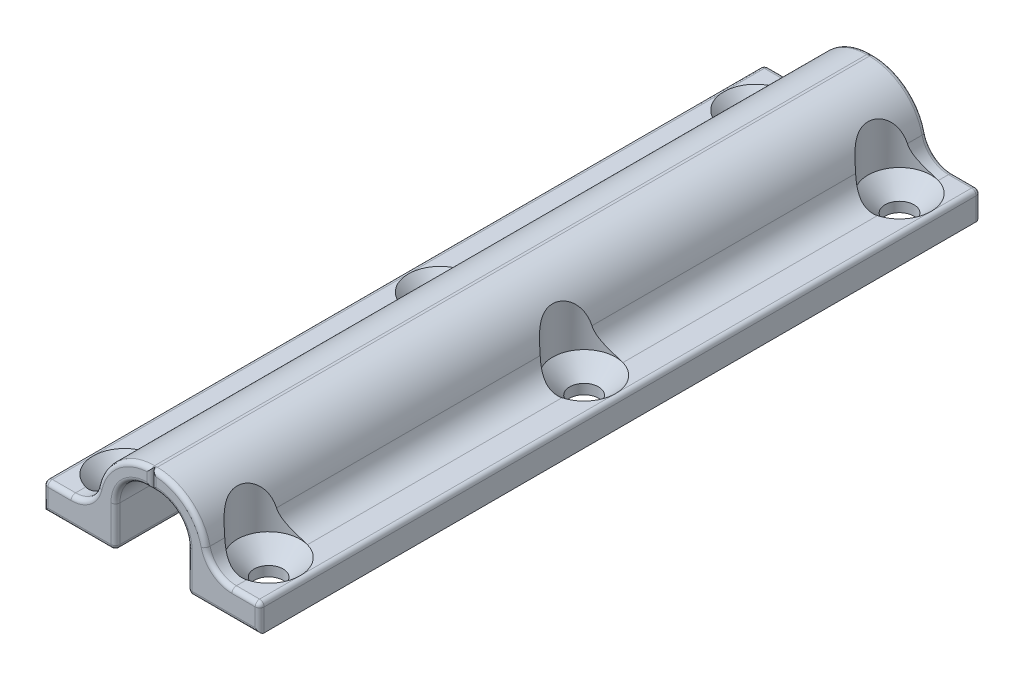
from build123d import *

# Parameters (mm, degrees)
BOSS_EXTRUDE1_DEPTH                            = 80
SKETCH2_R                                      = 1.4
CUT_EXTRUDE1_DEPTH                             = 82.197290595
CSK_FOR_M5_FLAT_HEAD_MACHINE_SCREW1_AT_2_COUNT = 2
CSK_FOR_M5_FLAT_HEAD_MACHINE_SCREW1_AT_2_PITCH = 35
CSK_FOR_M5_FLAT_HEAD_MACHINE_SCREW1_AT_3_COUNT = 2
CSK_FOR_M5_FLAT_HEAD_MACHINE_SCREW1_AT_3_PITCH = 70
SKETCH6_R                                      = 3.5
CUT_EXTRUDE2_DEPTH                             = 82.197290694
FILLET1_R                                      = 0.5


# Read off the part's stored shape, not the designer's step: Mirror1
with BuildPart() as part:
    # Sketch1 → Boss-Extrude1 (new body)
    with BuildSketch(Plane.XY):
        with BuildLine():
            Line((4, 0), (12, 0))
            Line((12, 0), (12, 3))
            Line((12, 3), (8.924988129, 3))
            ThreePointArc((8.924988129, 3), (7.054159436, 3.65479212), (6, 5.333333333))
            ThreePointArc((6, 5.333333333), (3.891681129, 8.69041576), (0.150023742, 10))
            Line((0.150023742, 10), (0, 10))
            Line((0, 10), (0, 8))
            Line((0, 8), (0.5, 8))
            ThreePointArc((0.5, 8), (2.974873734, 6.974873734), (4, 4.5))
            Line((4, 4.5), (4, 0))
        make_face()
    extrude(amount=BOSS_EXTRUDE1_DEPTH)

    # Sketch2 → Cut-Extrude1 (cut, symmetric)
    with BuildSketch(Plane(origin=(0, 3, 0), x_dir=(1, 0, 0), z_dir=(0, 1, 0))):
        with Locations(Location((8, -40, 0), (0, 0, 180))):
            Circle(SKETCH2_R)
        with Locations(Location((8, -5, 0), (0, 0, 180))):
            Circle(SKETCH2_R)
        with Locations(Location((8, -75, 0), (0, 0, 180))):
            Circle(SKETCH2_R)
    extrude(amount=CUT_EXTRUDE1_DEPTH, both=True, mode=Mode.SUBTRACT)

    # Sketch4 → CSK for M5 Flat Head Machine Screw1 (revolve, cut)
    with BuildSketch(Plane(origin=(8, 3, 75), x_dir=(0, 0, 1), z_dir=(1, 0, 0))):
        Polygon((0, 0), (0, 3), (1.6, 3), (1.6, 1.9), (3.5, 0), align=None)
    csk_for_m5_flat_head_machine_screw1 = revolve(axis=Axis((8, 9.35, 75), (0, -1, 0)), mode=Mode.SUBTRACT)

    # CSK for M5 Flat Head Machine Screw1 at 2: CSK for M5 Flat Head Machine Screw1 ×2
    with Locations(*[(0, 0, -i * CSK_FOR_M5_FLAT_HEAD_MACHINE_SCREW1_AT_2_PITCH) for i in range(1, CSK_FOR_M5_FLAT_HEAD_MACHINE_SCREW1_AT_2_COUNT)]):
        add(csk_for_m5_flat_head_machine_screw1, mode=Mode.SUBTRACT)

    # CSK for M5 Flat Head Machine Screw1 at 3: CSK for M5 Flat Head Machine Screw1 ×2
    with Locations(*[(0, 0, -i * CSK_FOR_M5_FLAT_HEAD_MACHINE_SCREW1_AT_3_PITCH) for i in range(1, CSK_FOR_M5_FLAT_HEAD_MACHINE_SCREW1_AT_3_COUNT)]):
        add(csk_for_m5_flat_head_machine_screw1, mode=Mode.SUBTRACT)

    # Sketch6 → Cut-Extrude2 (cut, through all)
    with BuildSketch(Plane(origin=(0, 3, 0), x_dir=(1, 0, 0), z_dir=(0, 1, 0))):
        with Locations((8, -75)):
            Circle(SKETCH6_R)
        with Locations((8, -40)):
            Circle(SKETCH6_R)
        with Locations((8, -5)):
            Circle(SKETCH6_R)
    extrude(amount=CUT_EXTRUDE2_DEPTH, mode=Mode.SUBTRACT)

    # Fillet1
    # the kernel refuses this fillet: 0.5 mm, written as the material it takes off along each edge
    with BuildSketch(Plane(origin=(4.5, 0.5, 0.5), x_dir=(-1, 0, 0), z_dir=(0, -1, 0))) as fillet1_piece_1_section:
        Polygon((0, 0), (FILLET1_R, 0), (FILLET1_R, FILLET1_R), (0, FILLET1_R), align=None)
    fillet1_piece_1 = extrude(amount=FILLET1_R, mode=Mode.PRIVATE)
    fillet1_piece_1 = fillet1_piece_1 - Plane(origin=(4.5, 0.5, 0.5), x_dir=(0.7071067811865475, 0, 0.7071067811865475), z_dir=(0, -1, 0)) * Sphere(FILLET1_R, mode=Mode.PRIVATE)
    add(fillet1_piece_1, mode=Mode.SUBTRACT)
    with BuildSketch(Plane(origin=(4.5, 0.5, 79.5), x_dir=(-1, 0, 0), z_dir=(0, -1, 0))) as fillet1_piece_2_section:
        Polygon((0, 0), (FILLET1_R, 0), (FILLET1_R, -FILLET1_R), (0, -FILLET1_R), align=None)
    fillet1_piece_2 = extrude(amount=FILLET1_R, mode=Mode.PRIVATE)
    fillet1_piece_2 = fillet1_piece_2 - Plane(origin=(4.5, 0.5, 79.5), x_dir=(0.7071067811865475, 0, -0.7071067811865475), z_dir=(0, -1, 0)) * Sphere(FILLET1_R, mode=Mode.PRIVATE)
    add(fillet1_piece_2, mode=Mode.SUBTRACT)
    with BuildSketch(Plane(origin=(11.5, 2.5, 0.5), x_dir=(0, 0, -1), z_dir=(1, 0, 0))) as fillet1_piece_3_section:
        Polygon((0, 0), (FILLET1_R, 0), (FILLET1_R, FILLET1_R), (0, FILLET1_R), align=None)
    fillet1_piece_3 = extrude(amount=FILLET1_R, mode=Mode.PRIVATE)
    fillet1_piece_3 = fillet1_piece_3 - Plane(origin=(11.5, 2.5, 0.5), x_dir=(0, -0.7071067811865475, 0.7071067811865475), z_dir=(1, 0, 0)) * Sphere(FILLET1_R, mode=Mode.PRIVATE)
    add(fillet1_piece_3, mode=Mode.SUBTRACT)
    with BuildSketch(Plane(origin=(11.5, 2.5, 79.5), x_dir=(0, 0, 1), z_dir=(1, 0, 0))) as fillet1_piece_4_section:
        Polygon((0, 0), (FILLET1_R, 0), (FILLET1_R, -FILLET1_R), (0, -FILLET1_R), align=None)
    fillet1_piece_4 = extrude(amount=FILLET1_R, mode=Mode.PRIVATE)
    fillet1_piece_4 = fillet1_piece_4 - Plane(origin=(11.5, 2.5, 79.5), x_dir=(0, -0.7071067811865475, -0.7071067811865475), z_dir=(1, 0, 0)) * Sphere(FILLET1_R, mode=Mode.PRIVATE)
    add(fillet1_piece_4, mode=Mode.SUBTRACT)
    with BuildSketch(Plane(origin=(4, 0, 0.5), x_dir=(1, 0, 0), z_dir=(0, 0, 1)), Plane(origin=(12, 3, 0.5), x_dir=(-1, 0, 0), z_dir=(0, 0, 1))) as fillet1_piece_5:
        with BuildLine():
            CenterArc((FILLET1_R, FILLET1_R), FILLET1_R, 180, 90)
            Line((0, FILLET1_R), (0, 0))
            Line((0, 0), (FILLET1_R, 0))
        make_face()
    extrude(amount=79, mode=Mode.SUBTRACT)
    with BuildSketch(Plane(origin=(4.5, 0, 0), x_dir=(0, 0, 1), z_dir=(1, 0, 0)), Plane(origin=(4.5, 0, 80), x_dir=(0, 1, 0), z_dir=(1, 0, 0))) as fillet1_piece_6:
        with BuildLine():
            CenterArc((FILLET1_R, -FILLET1_R), FILLET1_R, 90, 90)
            Line((0, -FILLET1_R), (0, 0))
            Line((0, 0), (FILLET1_R, 0))
        make_face()
    extrude(amount=8.75, mode=Mode.SUBTRACT)
    with BuildSketch(Plane(origin=(12, -1.25, 0), x_dir=(0, 0, 1), z_dir=(0, 1, 0)), Plane(origin=(12, -1.25, 80), x_dir=(-1, 0, 0), z_dir=(0, 1, 0))) as fillet1_piece_7:
        with BuildLine():
            CenterArc((FILLET1_R, -FILLET1_R), FILLET1_R, 90, 90)
            Line((0, -FILLET1_R), (0, 0))
            Line((0, 0), (FILLET1_R, 0))
        make_face()
    extrude(amount=3.75, mode=Mode.SUBTRACT)
    with BuildSketch(Plane(origin=(11.5, 3, 0), x_dir=(0, 0, 1), z_dir=(-1, 0, 0)), Plane(origin=(11.5, 3, 80), x_dir=(0, -1, 0), z_dir=(-1, 0, 0))) as fillet1_piece_8:
        with BuildLine():
            CenterArc((FILLET1_R, -FILLET1_R), FILLET1_R, 90, 90)
            Line((0, -FILLET1_R), (0, 0))
            Line((0, 0), (FILLET1_R, 0))
        make_face()
    extrude(amount=2.575011871, mode=Mode.SUBTRACT)
    with BuildSketch(Plane(origin=(8.924988129, 6, 0), x_dir=(0, -1, 0), z_dir=(1, 0, 0))) as fillet1_piece_9:
        with BuildLine():
            CenterArc((3 + FILLET1_R, -FILLET1_R), FILLET1_R, 90, 90)
            Line((3 + FILLET1_R, 0), (3, 0))
            Line((3, 0), (3, -FILLET1_R))
        make_face()
    revolve(axis=Axis((8.924988129, 6, 0), (0, 0, -1)), revolution_arc=77.160411593, mode=Mode.SUBTRACT)
    with BuildSketch(Plane(origin=(0.150023742, 4, 0), x_dir=(0.9749960430435692, 0.22222222222222177, 0), z_dir=(0.22222222222222177, -0.9749960430435692, 0))) as fillet1_piece_10:
        with BuildLine():
            CenterArc((6 - FILLET1_R, FILLET1_R), FILLET1_R, 270, 90)
            Line((6, FILLET1_R), (6, 0))
            Line((6, 0), (6 - FILLET1_R, 0))
        make_face()
    revolve(axis=Axis((0.150023742, 4, 0), (0, 0, 1)), revolution_arc=77.160411593, mode=Mode.SUBTRACT)
    with BuildSketch(Plane(origin=(0, 11.25, 0), x_dir=(1, 0, 0), z_dir=(0, -1, 0))) as fillet1_piece_11:
        with BuildLine():
            CenterArc((FILLET1_R, FILLET1_R), FILLET1_R, 180, 90)
            Line((0, FILLET1_R), (0, 0))
            Line((0, 0), (FILLET1_R, 0))
        make_face()
    extrude(amount=4.5, mode=Mode.SUBTRACT)
    with BuildSketch(Plane(origin=(-1.25, 8, 0), x_dir=(0, 0, 1), z_dir=(1, 0, 0)), Plane(origin=(-1.25, 8, 80), x_dir=(0, 1, 0), z_dir=(1, 0, 0))) as fillet1_piece_12:
        with BuildLine():
            CenterArc((FILLET1_R, -FILLET1_R), FILLET1_R, 90, 90)
            Line((0, -FILLET1_R), (0, 0))
            Line((0, 0), (FILLET1_R, 0))
        make_face()
    extrude(amount=1.75, mode=Mode.SUBTRACT)
    with BuildSketch(Plane(origin=(0.5, 4.5, 0), x_dir=(0, 1, 0), z_dir=(-1, 0, 0))) as fillet1_piece_13:
        with BuildLine():
            CenterArc((3.5 + FILLET1_R, -FILLET1_R), FILLET1_R, 90, 90)
            Line((3.5 + FILLET1_R, 0), (3.5, 0))
            Line((3.5, 0), (3.5, -FILLET1_R))
        make_face()
    revolve(axis=Axis((0.5, 4.5, 0), (0, 0, -1)), revolution_arc=90, mode=Mode.SUBTRACT)
    with BuildSketch(Plane(origin=(4, 4.5, 0), x_dir=(0, 0, 1), z_dir=(0, -1, 0)), Plane(origin=(4, 4.5, 80), x_dir=(1, 0, 0), z_dir=(0, -1, 0))) as fillet1_piece_14:
        with BuildLine():
            CenterArc((FILLET1_R, -FILLET1_R), FILLET1_R, 90, 90)
            Line((0, -FILLET1_R), (0, 0))
            Line((0, 0), (FILLET1_R, 0))
        make_face()
    extrude(amount=4, mode=Mode.SUBTRACT)
    with BuildSketch(Plane(origin=(0.5, 4.5, 80), x_dir=(0, 1, 0), z_dir=(-1, 0, 0))) as fillet1_piece_15:
        with BuildLine():
            CenterArc((3.5 + FILLET1_R, FILLET1_R), FILLET1_R, 180, 90)
            Line((3.5, FILLET1_R), (3.5, 0))
            Line((3.5, 0), (3.5 + FILLET1_R, 0))
        make_face()
    revolve(axis=Axis((0.5, 4.5, 80), (0, 0, -1)), revolution_arc=90, mode=Mode.SUBTRACT)
    with BuildSketch(Plane(origin=(0, 11.25, 80), x_dir=(1, 0, 0), z_dir=(0, -1, 0))) as fillet1_piece_16:
        with BuildLine():
            CenterArc((FILLET1_R, -FILLET1_R), FILLET1_R, 90, 90)
            Line((0, -FILLET1_R), (0, 0))
            Line((0, 0), (FILLET1_R, 0))
        make_face()
    extrude(amount=4.5, mode=Mode.SUBTRACT)
    with BuildSketch(Plane(origin=(0.150023742, 4, 80), x_dir=(0.9749960430435692, 0.22222222222222177, 0), z_dir=(0.22222222222222177, -0.9749960430435692, 0))) as fillet1_piece_17:
        with BuildLine():
            CenterArc((6 - FILLET1_R, -FILLET1_R), FILLET1_R, 0, 90)
            Line((6, -FILLET1_R), (6, 0))
            Line((6, 0), (6 - FILLET1_R, 0))
        make_face()
    revolve(axis=Axis((0.150023742, 4, 80), (0, 0, 1)), revolution_arc=77.160411593, mode=Mode.SUBTRACT)
    with BuildSketch(Plane(origin=(8.924988129, 6, 80), x_dir=(0, -1, 0), z_dir=(1, 0, 0))) as fillet1_piece_18:
        with BuildLine():
            CenterArc((3 + FILLET1_R, FILLET1_R), FILLET1_R, 180, 90)
            Line((3, FILLET1_R), (3, 0))
            Line((3, 0), (3 + FILLET1_R, 0))
        make_face()
    revolve(axis=Axis((8.924988129, 6, 80), (0, 0, -1)), revolution_arc=77.160411593, mode=Mode.SUBTRACT)
    with BuildSketch(Plane(origin=(0.150023742, 10, 80), x_dir=(0, 0, -1), z_dir=(-1, 0, 0))) as fillet1_piece_19:
        with BuildLine():
            CenterArc((FILLET1_R, FILLET1_R), FILLET1_R, 180, 90)
            Line((0, FILLET1_R), (0, 0))
            Line((0, 0), (FILLET1_R, 0))
        make_face()
    extrude(amount=1.400023742, mode=Mode.SUBTRACT)
    with BuildSketch(Plane(origin=(0.150023742, 10, 0), x_dir=(0, 0, 1), z_dir=(-1, 0, 0))) as fillet1_piece_20:
        with BuildLine():
            CenterArc((FILLET1_R, -FILLET1_R), FILLET1_R, 90, 90)
            Line((0, -FILLET1_R), (0, 0))
            Line((0, 0), (FILLET1_R, 0))
        make_face()
    extrude(amount=1.400023742, mode=Mode.SUBTRACT)

    # Mirror1: part across plane


with BuildPart() as part_1:
    add(part.part)
    add(part.part.mirror(Plane(origin=(0, 10, 80), x_dir=(0, 0, 1), z_dir=(1, 0, 0))))


solid = part_1.part
